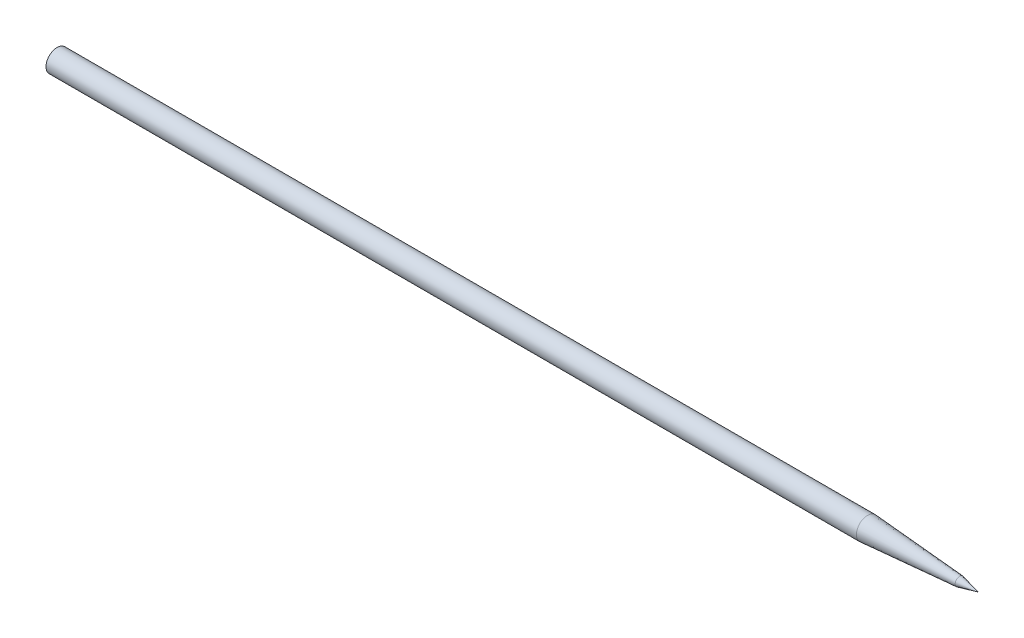
from build123d import *


with BuildPart() as part:
    # Sketch1 → Revolve1 (revolve)
    with BuildSketch(Plane.XY):
        Polygon((0, 0), (0, 3), (220, 3), (245, 1.2), (250, 0), align=None)
    revolve(axis=Axis((-10, 0, 0), (1, 0, 0)))


solid = part.part
